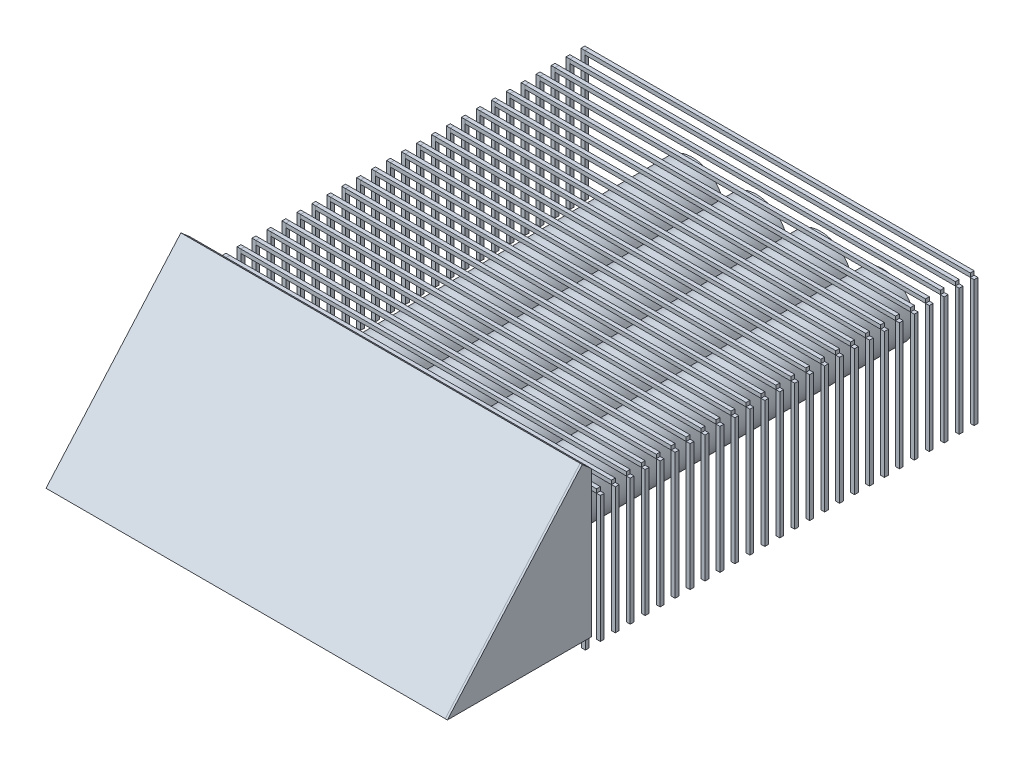
from build123d import *

# Parameters (mm, degrees)
SKETCH1_R              = 150
BOSS_EXTRUDE2_DEPTH    = 2000
BOSS_EXTRUDE2_2_DEPTH  = 2000
SKETCH1_R_2            = 143.570198384
BOSS_EXTRUDE2_3_DEPTH  = 2000
BOSS_EXTRUDE2_4_DEPTH  = 2000
EXTRUDE_THIN1_START    = -1430
EXTRUDE_THIN1_DEPTH    = 1859
SKETCH3_W              = 18
SKETCH3_H              = 592
BOSS_EXTRUDE3_DEPTH    = 18
BOSS_EXTRUDE3_2_DEPTH  = 18
BOSS_EXTRUDE3_3_DEPTH  = 18
BOSS_EXTRUDE3_4_DEPTH  = 18
BOSS_EXTRUDE3_5_DEPTH  = 18
BOSS_EXTRUDE3_6_DEPTH  = 18
BOSS_EXTRUDE3_7_DEPTH  = 18
BOSS_EXTRUDE3_8_DEPTH  = 18
BOSS_EXTRUDE3_9_DEPTH  = 18
BOSS_EXTRUDE3_10_DEPTH = 18
BOSS_EXTRUDE3_11_DEPTH = 18
BOSS_EXTRUDE3_12_DEPTH = 18
BOSS_EXTRUDE3_13_DEPTH = 18
BOSS_EXTRUDE3_14_DEPTH = 18
BOSS_EXTRUDE3_15_DEPTH = 18
BOSS_EXTRUDE3_16_DEPTH = 18
BOSS_EXTRUDE3_17_DEPTH = 18
BOSS_EXTRUDE3_18_DEPTH = 18
BOSS_EXTRUDE3_19_DEPTH = 18
BOSS_EXTRUDE3_20_DEPTH = 18
BOSS_EXTRUDE3_21_DEPTH = 18
BOSS_EXTRUDE3_22_DEPTH = 18
BOSS_EXTRUDE3_23_DEPTH = 18
BOSS_EXTRUDE3_24_DEPTH = 18
BOSS_EXTRUDE3_25_DEPTH = 18
BOSS_EXTRUDE3_26_DEPTH = 18
BOSS_EXTRUDE3_27_DEPTH = 18
SKETCH4_W              = 1804.350056171
SKETCH4_H              = 18
BOSS_EXTRUDE4_DEPTH    = 18
BOSS_EXTRUDE4_2_DEPTH  = 18
BOSS_EXTRUDE4_3_DEPTH  = 18
BOSS_EXTRUDE4_4_DEPTH  = 18
BOSS_EXTRUDE4_5_DEPTH  = 18
BOSS_EXTRUDE4_6_DEPTH  = 18
BOSS_EXTRUDE4_7_DEPTH  = 18
BOSS_EXTRUDE4_8_DEPTH  = 18
BOSS_EXTRUDE4_9_DEPTH  = 18
BOSS_EXTRUDE4_10_DEPTH = 18
BOSS_EXTRUDE4_11_DEPTH = 18
BOSS_EXTRUDE4_12_DEPTH = 18
BOSS_EXTRUDE4_13_DEPTH = 18
BOSS_EXTRUDE4_14_DEPTH = 18
BOSS_EXTRUDE4_15_DEPTH = 18
BOSS_EXTRUDE4_16_DEPTH = 18
BOSS_EXTRUDE4_17_DEPTH = 18
BOSS_EXTRUDE4_18_DEPTH = 18
BOSS_EXTRUDE4_19_DEPTH = 18
BOSS_EXTRUDE4_20_DEPTH = 18
BOSS_EXTRUDE4_21_DEPTH = 18
BOSS_EXTRUDE4_22_DEPTH = 18
BOSS_EXTRUDE4_23_DEPTH = 18
BOSS_EXTRUDE4_24_DEPTH = 18
BOSS_EXTRUDE4_25_DEPTH = 18
BOSS_EXTRUDE4_26_DEPTH = 18
BOSS_EXTRUDE4_27_DEPTH = 18
BOSS_EXTRUDE4_28_DEPTH = 18
SKETCH5_W              = 18
SKETCH5_H              = 610
BOSS_EXTRUDE5_DEPTH    = 18
BOSS_EXTRUDE6_DEPTH    = 10
BOSS_EXTRUDE7_DEPTH    = 10


# Read off the part's stored shape, not the designer's step: Extrude-Thin1
with BuildPart() as part:
    # Sketch1 → Boss-Extrude2 (new body)
    with BuildSketch(Plane.XY):
        with Locations((-958.339749738, -353.083207561)):
            Circle(SKETCH1_R)
    extrude(amount=BOSS_EXTRUDE2_DEPTH)


with BuildPart() as body_2:
    # Sketch1 → Boss-Extrude2 2 (new body)
    with BuildSketch(Plane.XY):
        with Locations((-658.339749738, -353.083207561)):
            Circle(SKETCH1_R)
    extrude(amount=BOSS_EXTRUDE2_2_DEPTH)


with BuildPart() as body_3:
    # Sketch1 → Boss-Extrude2 3 (new body)
    with BuildSketch(Plane.XY):
        with Locations((-64.769551354, -353.083207561)):
            Circle(SKETCH1_R_2)
    extrude(amount=BOSS_EXTRUDE2_3_DEPTH)


with BuildPart() as body_4:
    # Sketch1 → Boss-Extrude2 4 (new body)
    with BuildSketch(Plane.XY):
        with Locations((-358.339749738, -353.083207561)):
            Circle(SKETCH1_R)
    extrude(amount=BOSS_EXTRUDE2_4_DEPTH)


with BuildPart() as body_5:
    # Extrude-Thin1 outline → Extrude-Thin1 (new body)
    with BuildSketch(Plane(origin=(0, 0, 0), x_dir=(0, 0, -1), z_dir=(1, 0, 0)).offset(EXTRUDE_THIN1_START)):
        Polygon((-2466.56998023, -513.083207561), (-1869.132708893, 168.164895882), (-1913.207108363, 206.817023972), (-2544.541313609, -513.083207561), align=None)
        Polygon((-1912.282153442, 192.705168729), (-1883.244564136, 167.23994096), (-2471.100927688, -503.083207561), (-2522.470874494, -503.083207561), align=None, mode=Mode.SUBTRACT)
    extrude(amount=EXTRUDE_THIN1_DEPTH)

    # Sketch7 → Boss-Extrude7 (add)
    with BuildSketch(Plane.ZY.offset(1430)):
        Polygon((1913.207108363, 206.817023972), (1869.132708893, 168.164895882), (1888.666023324, -513.083207561), (2544.541313609, -513.083207561), align=None)
    extrude(amount=BOSS_EXTRUDE7_DEPTH)


with BuildPart() as body_6:
    # Sketch3 → Boss-Extrude3 (new body)
    with BuildSketch(Plane(origin=(429, 0, 0), x_dir=(0, 0, -1), z_dir=(1, 0, 0))):
        with Locations((-1879.666023324, -266.786552039)):
            Rectangle(SKETCH3_W, SKETCH3_H)
    extrude(amount=-BOSS_EXTRUDE3_DEPTH)

    # Sketch6 → Boss-Extrude6 (add)
    with BuildSketch(Plane(origin=(429, 0, 0), x_dir=(0, 0, -1), z_dir=(1, 0, 0))):
        Polygon((-2544.541313609, -513.083207561), (-1913.207108363, 206.817023972), (-1869.132708893, 168.164895882), (-1869.132708893, -513.083207561), align=None)
    extrude(amount=BOSS_EXTRUDE6_DEPTH)


with BuildPart() as body_7:
    # Sketch3 → Boss-Extrude3 2 (new body)
    with BuildSketch(Plane(origin=(429, 0, 0), x_dir=(0, 0, -1), z_dir=(1, 0, 0))):
        with Locations((-1809.666023324, -266.786552039)):
            Rectangle(SKETCH3_W, SKETCH3_H)
    extrude(amount=-BOSS_EXTRUDE3_2_DEPTH)


with BuildPart() as body_8:
    # Sketch3 → Boss-Extrude3 3 (new body)
    with BuildSketch(Plane(origin=(429, 0, 0), x_dir=(0, 0, -1), z_dir=(1, 0, 0))):
        with Locations((-1739.666023324, -266.786552039)):
            Rectangle(SKETCH3_W, SKETCH3_H)
    extrude(amount=-BOSS_EXTRUDE3_3_DEPTH)


with BuildPart() as body_9:
    # Sketch3 → Boss-Extrude3 4 (new body)
    with BuildSketch(Plane(origin=(429, 0, 0), x_dir=(0, 0, -1), z_dir=(1, 0, 0))):
        with Locations((-1669.666023324, -266.786552039)):
            Rectangle(SKETCH3_W, SKETCH3_H)
    extrude(amount=-BOSS_EXTRUDE3_4_DEPTH)


with BuildPart() as body_10:
    # Sketch3 → Boss-Extrude3 5 (new body)
    with BuildSketch(Plane(origin=(429, 0, 0), x_dir=(0, 0, -1), z_dir=(1, 0, 0))):
        with Locations((-1599.666023324, -266.786552039)):
            Rectangle(SKETCH3_W, SKETCH3_H)
    extrude(amount=-BOSS_EXTRUDE3_5_DEPTH)


with BuildPart() as body_11:
    # Sketch3 → Boss-Extrude3 6 (new body)
    with BuildSketch(Plane(origin=(429, 0, 0), x_dir=(0, 0, -1), z_dir=(1, 0, 0))):
        with Locations((-1529.666023324, -266.786552039)):
            Rectangle(SKETCH3_W, SKETCH3_H)
    extrude(amount=-BOSS_EXTRUDE3_6_DEPTH)


with BuildPart() as body_12:
    # Sketch3 → Boss-Extrude3 7 (new body)
    with BuildSketch(Plane(origin=(429, 0, 0), x_dir=(0, 0, -1), z_dir=(1, 0, 0))):
        with Locations((-1459.666023324, -266.786552039)):
            Rectangle(SKETCH3_W, SKETCH3_H)
    extrude(amount=-BOSS_EXTRUDE3_7_DEPTH)


with BuildPart() as body_13:
    # Sketch3 → Boss-Extrude3 8 (new body)
    with BuildSketch(Plane(origin=(429, 0, 0), x_dir=(0, 0, -1), z_dir=(1, 0, 0))):
        with Locations((-1389.666023324, -266.786552039)):
            Rectangle(SKETCH3_W, SKETCH3_H)
    extrude(amount=-BOSS_EXTRUDE3_8_DEPTH)


with BuildPart() as body_14:
    # Sketch3 → Boss-Extrude3 9 (new body)
    with BuildSketch(Plane(origin=(429, 0, 0), x_dir=(0, 0, -1), z_dir=(1, 0, 0))):
        with Locations((-1319.666023324, -266.786552039)):
            Rectangle(SKETCH3_W, SKETCH3_H)
    extrude(amount=-BOSS_EXTRUDE3_9_DEPTH)


with BuildPart() as body_15:
    # Sketch3 → Boss-Extrude3 10 (new body)
    with BuildSketch(Plane(origin=(429, 0, 0), x_dir=(0, 0, -1), z_dir=(1, 0, 0))):
        with Locations((-1249.666023324, -266.786552039)):
            Rectangle(SKETCH3_W, SKETCH3_H)
    extrude(amount=-BOSS_EXTRUDE3_10_DEPTH)


with BuildPart() as body_16:
    # Sketch3 → Boss-Extrude3 11 (new body)
    with BuildSketch(Plane(origin=(429, 0, 0), x_dir=(0, 0, -1), z_dir=(1, 0, 0))):
        with Locations((-1179.666023324, -266.786552039)):
            Rectangle(SKETCH3_W, SKETCH3_H)
    extrude(amount=-BOSS_EXTRUDE3_11_DEPTH)


with BuildPart() as body_17:
    # Sketch3 → Boss-Extrude3 12 (new body)
    with BuildSketch(Plane(origin=(429, 0, 0), x_dir=(0, 0, -1), z_dir=(1, 0, 0))):
        with Locations((-1109.666023324, -266.786552039)):
            Rectangle(SKETCH3_W, SKETCH3_H)
    extrude(amount=-BOSS_EXTRUDE3_12_DEPTH)


with BuildPart() as body_18:
    # Sketch3 → Boss-Extrude3 13 (new body)
    with BuildSketch(Plane(origin=(429, 0, 0), x_dir=(0, 0, -1), z_dir=(1, 0, 0))):
        with Locations((-1039.666023324, -266.786552039)):
            Rectangle(SKETCH3_W, SKETCH3_H)
    extrude(amount=-BOSS_EXTRUDE3_13_DEPTH)


with BuildPart() as body_19:
    # Sketch3 → Boss-Extrude3 14 (new body)
    with BuildSketch(Plane(origin=(429, 0, 0), x_dir=(0, 0, -1), z_dir=(1, 0, 0))):
        with Locations((-969.666023324, -266.786552039)):
            Rectangle(SKETCH3_W, SKETCH3_H)
    extrude(amount=-BOSS_EXTRUDE3_14_DEPTH)


with BuildPart() as body_20:
    # Sketch3 → Boss-Extrude3 15 (new body)
    with BuildSketch(Plane(origin=(429, 0, 0), x_dir=(0, 0, -1), z_dir=(1, 0, 0))):
        with Locations((-899.666023324, -266.786552039)):
            Rectangle(SKETCH3_W, SKETCH3_H)
    extrude(amount=-BOSS_EXTRUDE3_15_DEPTH)


with BuildPart() as body_21:
    # Sketch3 → Boss-Extrude3 16 (new body)
    with BuildSketch(Plane(origin=(429, 0, 0), x_dir=(0, 0, -1), z_dir=(1, 0, 0))):
        with Locations((-829.666023324, -266.786552039)):
            Rectangle(SKETCH3_W, SKETCH3_H)
    extrude(amount=-BOSS_EXTRUDE3_16_DEPTH)


with BuildPart() as body_22:
    # Sketch3 → Boss-Extrude3 17 (new body)
    with BuildSketch(Plane(origin=(429, 0, 0), x_dir=(0, 0, -1), z_dir=(1, 0, 0))):
        with Locations((-759.666023324, -266.786552039)):
            Rectangle(SKETCH3_W, SKETCH3_H)
    extrude(amount=-BOSS_EXTRUDE3_17_DEPTH)


with BuildPart() as body_23:
    # Sketch3 → Boss-Extrude3 18 (new body)
    with BuildSketch(Plane(origin=(429, 0, 0), x_dir=(0, 0, -1), z_dir=(1, 0, 0))):
        with Locations((-689.666023324, -266.786552039)):
            Rectangle(SKETCH3_W, SKETCH3_H)
    extrude(amount=-BOSS_EXTRUDE3_18_DEPTH)


with BuildPart() as body_24:
    # Sketch3 → Boss-Extrude3 19 (new body)
    with BuildSketch(Plane(origin=(429, 0, 0), x_dir=(0, 0, -1), z_dir=(1, 0, 0))):
        with Locations((-619.666023324, -266.786552039)):
            Rectangle(SKETCH3_W, SKETCH3_H)
    extrude(amount=-BOSS_EXTRUDE3_19_DEPTH)


with BuildPart() as body_25:
    # Sketch3 → Boss-Extrude3 20 (new body)
    with BuildSketch(Plane(origin=(429, 0, 0), x_dir=(0, 0, -1), z_dir=(1, 0, 0))):
        with Locations((-549.666023324, -266.786552039)):
            Rectangle(SKETCH3_W, SKETCH3_H)
    extrude(amount=-BOSS_EXTRUDE3_20_DEPTH)


with BuildPart() as body_26:
    # Sketch3 → Boss-Extrude3 21 (new body)
    with BuildSketch(Plane(origin=(429, 0, 0), x_dir=(0, 0, -1), z_dir=(1, 0, 0))):
        with Locations((-479.666023324, -266.786552039)):
            Rectangle(SKETCH3_W, SKETCH3_H)
    extrude(amount=-BOSS_EXTRUDE3_21_DEPTH)


with BuildPart() as body_27:
    # Sketch3 → Boss-Extrude3 22 (new body)
    with BuildSketch(Plane(origin=(429, 0, 0), x_dir=(0, 0, -1), z_dir=(1, 0, 0))):
        with Locations((-409.666023324, -266.786552039)):
            Rectangle(SKETCH3_W, SKETCH3_H)
    extrude(amount=-BOSS_EXTRUDE3_22_DEPTH)


with BuildPart() as body_28:
    # Sketch3 → Boss-Extrude3 23 (new body)
    with BuildSketch(Plane(origin=(429, 0, 0), x_dir=(0, 0, -1), z_dir=(1, 0, 0))):
        with Locations((-339.666023324, -266.786552039)):
            Rectangle(SKETCH3_W, SKETCH3_H)
    extrude(amount=-BOSS_EXTRUDE3_23_DEPTH)


with BuildPart() as body_29:
    # Sketch3 → Boss-Extrude3 24 (new body)
    with BuildSketch(Plane(origin=(429, 0, 0), x_dir=(0, 0, -1), z_dir=(1, 0, 0))):
        with Locations((-269.666023324, -266.786552039)):
            Rectangle(SKETCH3_W, SKETCH3_H)
    extrude(amount=-BOSS_EXTRUDE3_24_DEPTH)


with BuildPart() as body_30:
    # Sketch3 → Boss-Extrude3 25 (new body)
    with BuildSketch(Plane(origin=(429, 0, 0), x_dir=(0, 0, -1), z_dir=(1, 0, 0))):
        with Locations((-199.666023324, -266.786552039)):
            Rectangle(SKETCH3_W, SKETCH3_H)
    extrude(amount=-BOSS_EXTRUDE3_25_DEPTH)


with BuildPart() as body_31:
    # Sketch3 → Boss-Extrude3 26 (new body)
    with BuildSketch(Plane(origin=(429, 0, 0), x_dir=(0, 0, -1), z_dir=(1, 0, 0))):
        with Locations((-129.666023324, -266.786552039)):
            Rectangle(SKETCH3_W, SKETCH3_H)
    extrude(amount=-BOSS_EXTRUDE3_26_DEPTH)


with BuildPart() as body_32:
    # Sketch3 → Boss-Extrude3 27 (new body)
    with BuildSketch(Plane(origin=(429, 0, 0), x_dir=(0, 0, -1), z_dir=(1, 0, 0))):
        with Locations((-59.666023324, -266.786552039)):
            Rectangle(SKETCH3_W, SKETCH3_H)
    extrude(amount=-BOSS_EXTRUDE3_27_DEPTH)


with BuildPart() as body_33:
    # Sketch4 → Boss-Extrude4 (new body)
    with BuildSketch(Plane(origin=(0, 29.213447961, 0), x_dir=(1, 0, 0), z_dir=(0, 1, 0))):
        with Locations((-491.175028086, -59.666023324)):
            Rectangle(SKETCH4_W, SKETCH4_H)
    extrude(amount=BOSS_EXTRUDE4_DEPTH)


with BuildPart() as body_34:
    # Sketch4 → Boss-Extrude4 2 (new body)
    with BuildSketch(Plane(origin=(0, 29.213447961, 0), x_dir=(1, 0, 0), z_dir=(0, 1, 0))):
        with Locations((-491.175028086, -129.666023324)):
            Rectangle(SKETCH4_W, SKETCH4_H)
    extrude(amount=BOSS_EXTRUDE4_2_DEPTH)


with BuildPart() as body_35:
    # Sketch4 → Boss-Extrude4 3 (new body)
    with BuildSketch(Plane(origin=(0, 29.213447961, 0), x_dir=(1, 0, 0), z_dir=(0, 1, 0))):
        with Locations((-491.175028086, -199.666023324)):
            Rectangle(SKETCH4_W, SKETCH4_H)
    extrude(amount=BOSS_EXTRUDE4_3_DEPTH)


with BuildPart() as body_36:
    # Sketch4 → Boss-Extrude4 4 (new body)
    with BuildSketch(Plane(origin=(0, 29.213447961, 0), x_dir=(1, 0, 0), z_dir=(0, 1, 0))):
        with Locations((-491.175028086, -269.666023324)):
            Rectangle(SKETCH4_W, SKETCH4_H)
    extrude(amount=BOSS_EXTRUDE4_4_DEPTH)


with BuildPart() as body_37:
    # Sketch4 → Boss-Extrude4 5 (new body)
    with BuildSketch(Plane(origin=(0, 29.213447961, 0), x_dir=(1, 0, 0), z_dir=(0, 1, 0))):
        with Locations((-491.175028086, -339.666023324)):
            Rectangle(SKETCH4_W, SKETCH4_H)
    extrude(amount=BOSS_EXTRUDE4_5_DEPTH)


with BuildPart() as body_38:
    # Sketch4 → Boss-Extrude4 6 (new body)
    with BuildSketch(Plane(origin=(0, 29.213447961, 0), x_dir=(1, 0, 0), z_dir=(0, 1, 0))):
        with Locations((-491.175028086, -409.666023324)):
            Rectangle(SKETCH4_W, SKETCH4_H)
    extrude(amount=BOSS_EXTRUDE4_6_DEPTH)


with BuildPart() as body_39:
    # Sketch4 → Boss-Extrude4 7 (new body)
    with BuildSketch(Plane(origin=(0, 29.213447961, 0), x_dir=(1, 0, 0), z_dir=(0, 1, 0))):
        with Locations((-491.175028086, -479.666023324)):
            Rectangle(SKETCH4_W, SKETCH4_H)
    extrude(amount=BOSS_EXTRUDE4_7_DEPTH)


with BuildPart() as body_40:
    # Sketch4 → Boss-Extrude4 8 (new body)
    with BuildSketch(Plane(origin=(0, 29.213447961, 0), x_dir=(1, 0, 0), z_dir=(0, 1, 0))):
        with Locations((-491.175028086, -549.666023324)):
            Rectangle(SKETCH4_W, SKETCH4_H)
    extrude(amount=BOSS_EXTRUDE4_8_DEPTH)


with BuildPart() as body_41:
    # Sketch4 → Boss-Extrude4 9 (new body)
    with BuildSketch(Plane(origin=(0, 29.213447961, 0), x_dir=(1, 0, 0), z_dir=(0, 1, 0))):
        with Locations((-491.175028086, -619.666023324)):
            Rectangle(SKETCH4_W, SKETCH4_H)
    extrude(amount=BOSS_EXTRUDE4_9_DEPTH)


with BuildPart() as body_42:
    # Sketch4 → Boss-Extrude4 10 (new body)
    with BuildSketch(Plane(origin=(0, 29.213447961, 0), x_dir=(1, 0, 0), z_dir=(0, 1, 0))):
        with Locations((-491.175028086, -689.666023324)):
            Rectangle(SKETCH4_W, SKETCH4_H)
    extrude(amount=BOSS_EXTRUDE4_10_DEPTH)


with BuildPart() as body_43:
    # Sketch4 → Boss-Extrude4 11 (new body)
    with BuildSketch(Plane(origin=(0, 29.213447961, 0), x_dir=(1, 0, 0), z_dir=(0, 1, 0))):
        with Locations((-491.175028086, -759.666023324)):
            Rectangle(SKETCH4_W, SKETCH4_H)
    extrude(amount=BOSS_EXTRUDE4_11_DEPTH)


with BuildPart() as body_44:
    # Sketch4 → Boss-Extrude4 12 (new body)
    with BuildSketch(Plane(origin=(0, 29.213447961, 0), x_dir=(1, 0, 0), z_dir=(0, 1, 0))):
        with Locations((-491.175028086, -829.666023324)):
            Rectangle(SKETCH4_W, SKETCH4_H)
    extrude(amount=BOSS_EXTRUDE4_12_DEPTH)


with BuildPart() as body_45:
    # Sketch4 → Boss-Extrude4 13 (new body)
    with BuildSketch(Plane(origin=(0, 29.213447961, 0), x_dir=(1, 0, 0), z_dir=(0, 1, 0))):
        with Locations((-491.175028086, -899.666023324)):
            Rectangle(SKETCH4_W, SKETCH4_H)
    extrude(amount=BOSS_EXTRUDE4_13_DEPTH)


with BuildPart() as body_46:
    # Sketch4 → Boss-Extrude4 14 (new body)
    with BuildSketch(Plane(origin=(0, 29.213447961, 0), x_dir=(1, 0, 0), z_dir=(0, 1, 0))):
        with Locations((-491.175028086, -969.666023324)):
            Rectangle(SKETCH4_W, SKETCH4_H)
    extrude(amount=BOSS_EXTRUDE4_14_DEPTH)


with BuildPart() as body_47:
    # Sketch4 → Boss-Extrude4 15 (new body)
    with BuildSketch(Plane(origin=(0, 29.213447961, 0), x_dir=(1, 0, 0), z_dir=(0, 1, 0))):
        with Locations((-491.175028086, -1039.666023324)):
            Rectangle(SKETCH4_W, SKETCH4_H)
    extrude(amount=BOSS_EXTRUDE4_15_DEPTH)


with BuildPart() as body_48:
    # Sketch4 → Boss-Extrude4 16 (new body)
    with BuildSketch(Plane(origin=(0, 29.213447961, 0), x_dir=(1, 0, 0), z_dir=(0, 1, 0))):
        with Locations((-491.175028086, -1109.666023324)):
            Rectangle(SKETCH4_W, SKETCH4_H)
    extrude(amount=BOSS_EXTRUDE4_16_DEPTH)


with BuildPart() as body_49:
    # Sketch4 → Boss-Extrude4 17 (new body)
    with BuildSketch(Plane(origin=(0, 29.213447961, 0), x_dir=(1, 0, 0), z_dir=(0, 1, 0))):
        with Locations((-491.175028086, -1179.666023324)):
            Rectangle(SKETCH4_W, SKETCH4_H)
    extrude(amount=BOSS_EXTRUDE4_17_DEPTH)


with BuildPart() as body_50:
    # Sketch4 → Boss-Extrude4 18 (new body)
    with BuildSketch(Plane(origin=(0, 29.213447961, 0), x_dir=(1, 0, 0), z_dir=(0, 1, 0))):
        with Locations((-491.175028086, -1249.666023324)):
            Rectangle(SKETCH4_W, SKETCH4_H)
    extrude(amount=BOSS_EXTRUDE4_18_DEPTH)


with BuildPart() as body_51:
    # Sketch4 → Boss-Extrude4 19 (new body)
    with BuildSketch(Plane(origin=(0, 29.213447961, 0), x_dir=(1, 0, 0), z_dir=(0, 1, 0))):
        with Locations((-491.175028086, -1319.666023324)):
            Rectangle(SKETCH4_W, SKETCH4_H)
    extrude(amount=BOSS_EXTRUDE4_19_DEPTH)


with BuildPart() as body_52:
    # Sketch4 → Boss-Extrude4 20 (new body)
    with BuildSketch(Plane(origin=(0, 29.213447961, 0), x_dir=(1, 0, 0), z_dir=(0, 1, 0))):
        with Locations((-491.175028086, -1389.666023324)):
            Rectangle(SKETCH4_W, SKETCH4_H)
    extrude(amount=BOSS_EXTRUDE4_20_DEPTH)


with BuildPart() as body_53:
    # Sketch4 → Boss-Extrude4 21 (new body)
    with BuildSketch(Plane(origin=(0, 29.213447961, 0), x_dir=(1, 0, 0), z_dir=(0, 1, 0))):
        with Locations((-491.175028086, -1459.666023324)):
            Rectangle(SKETCH4_W, SKETCH4_H)
    extrude(amount=BOSS_EXTRUDE4_21_DEPTH)


with BuildPart() as body_54:
    # Sketch4 → Boss-Extrude4 22 (new body)
    with BuildSketch(Plane(origin=(0, 29.213447961, 0), x_dir=(1, 0, 0), z_dir=(0, 1, 0))):
        with Locations((-491.175028086, -1529.666023324)):
            Rectangle(SKETCH4_W, SKETCH4_H)
    extrude(amount=BOSS_EXTRUDE4_22_DEPTH)


with BuildPart() as body_55:
    # Sketch4 → Boss-Extrude4 23 (new body)
    with BuildSketch(Plane(origin=(0, 29.213447961, 0), x_dir=(1, 0, 0), z_dir=(0, 1, 0))):
        with Locations((-491.175028086, -1599.666023324)):
            Rectangle(SKETCH4_W, SKETCH4_H)
    extrude(amount=BOSS_EXTRUDE4_23_DEPTH)


with BuildPart() as body_56:
    # Sketch4 → Boss-Extrude4 24 (new body)
    with BuildSketch(Plane(origin=(0, 29.213447961, 0), x_dir=(1, 0, 0), z_dir=(0, 1, 0))):
        with Locations((-491.175028086, -1669.666023324)):
            Rectangle(SKETCH4_W, SKETCH4_H)
    extrude(amount=BOSS_EXTRUDE4_24_DEPTH)


with BuildPart() as body_57:
    # Sketch4 → Boss-Extrude4 25 (new body)
    with BuildSketch(Plane(origin=(0, 29.213447961, 0), x_dir=(1, 0, 0), z_dir=(0, 1, 0))):
        with Locations((-491.175028086, -1739.666023324)):
            Rectangle(SKETCH4_W, SKETCH4_H)
    extrude(amount=BOSS_EXTRUDE4_25_DEPTH)


with BuildPart() as body_58:
    # Sketch4 → Boss-Extrude4 26 (new body)
    with BuildSketch(Plane(origin=(0, 29.213447961, 0), x_dir=(1, 0, 0), z_dir=(0, 1, 0))):
        with Locations((-491.175028086, -1809.666023324)):
            Rectangle(SKETCH4_W, SKETCH4_H)
    extrude(amount=BOSS_EXTRUDE4_26_DEPTH)


with BuildPart() as body_59:
    # Sketch4 → Boss-Extrude4 27 (new body)
    with BuildSketch(Plane(origin=(0, 29.213447961, 0), x_dir=(1, 0, 0), z_dir=(0, 1, 0))):
        with Locations((-491.175028086, -1879.666023324)):
            Rectangle(SKETCH4_W, SKETCH4_H)
    extrude(amount=BOSS_EXTRUDE4_27_DEPTH)


with BuildPart() as body_60:
    # Sketch4 → Boss-Extrude4 28 (new body)
    with BuildSketch(Plane(origin=(0, 29.213447961, 0), x_dir=(1, 0, 0), z_dir=(0, 1, 0))):
        with Locations((-491.175028086, -1949.666023324)):
            Rectangle(SKETCH4_W, SKETCH4_H)
    extrude(amount=BOSS_EXTRUDE4_28_DEPTH)

    # Sketch5 → Boss-Extrude5 (add)
    with BuildSketch(Plane.ZY.offset(1393.350056171)):
        with Locations((129.666023324, -257.786552039)):
            Rectangle(SKETCH5_W, SKETCH5_H)
        with Locations((59.666023324, -257.786552039)):
            Rectangle(SKETCH5_W, SKETCH5_H)
        with Locations((199.666023324, -257.786552039)):
            Rectangle(SKETCH5_W, SKETCH5_H)
        with Locations((269.666023324, -257.786552039)):
            Rectangle(SKETCH5_W, SKETCH5_H)
        with Locations((339.666023324, -257.786552039)):
            Rectangle(SKETCH5_W, SKETCH5_H)
        with Locations((409.666023324, -257.786552039)):
            Rectangle(SKETCH5_W, SKETCH5_H)
        with Locations((479.666023324, -257.786552039)):
            Rectangle(SKETCH5_W, SKETCH5_H)
        with Locations((549.666023324, -257.786552039)):
            Rectangle(SKETCH5_W, SKETCH5_H)
        with Locations((619.666023324, -257.786552039)):
            Rectangle(SKETCH5_W, SKETCH5_H)
        with Locations((689.666023324, -257.786552039)):
            Rectangle(SKETCH5_W, SKETCH5_H)
        with Locations((759.666023324, -257.786552039)):
            Rectangle(SKETCH5_W, SKETCH5_H)
        with Locations((829.666023324, -257.786552039)):
            Rectangle(SKETCH5_W, SKETCH5_H)
        with Locations((899.666023324, -257.786552039)):
            Rectangle(SKETCH5_W, SKETCH5_H)
        with Locations((969.666023324, -257.786552039)):
            Rectangle(SKETCH5_W, SKETCH5_H)
        with Locations((1039.666023324, -257.786552039)):
            Rectangle(SKETCH5_W, SKETCH5_H)
        with Locations((1109.666023324, -257.786552039)):
            Rectangle(SKETCH5_W, SKETCH5_H)
        with Locations((1179.666023324, -257.786552039)):
            Rectangle(SKETCH5_W, SKETCH5_H)
        with Locations((1249.666023324, -257.786552039)):
            Rectangle(SKETCH5_W, SKETCH5_H)
        with Locations((1319.666023324, -257.786552039)):
            Rectangle(SKETCH5_W, SKETCH5_H)
        with Locations((1389.666023324, -257.786552039)):
            Rectangle(SKETCH5_W, SKETCH5_H)
        with Locations((1459.666023324, -257.786552039)):
            Rectangle(SKETCH5_W, SKETCH5_H)
        with Locations((1529.666023324, -257.786552039)):
            Rectangle(SKETCH5_W, SKETCH5_H)
        with Locations((1599.666023324, -257.786552039)):
            Rectangle(SKETCH5_W, SKETCH5_H)
        with Locations((1669.666023324, -257.786552039)):
            Rectangle(SKETCH5_W, SKETCH5_H)
        with Locations((1739.666023324, -257.786552039)):
            Rectangle(SKETCH5_W, SKETCH5_H)
        with Locations((1809.666023324, -257.786552039)):
            Rectangle(SKETCH5_W, SKETCH5_H)
        with Locations((1879.666023324, -257.786552039)):
            Rectangle(SKETCH5_W, SKETCH5_H)
        with Locations((1949.666023324, -257.786552039)):
            Rectangle(SKETCH5_W, SKETCH5_H)
    extrude(amount=BOSS_EXTRUDE5_DEPTH)


solid = Compound([part.part, body_2.part, body_3.part, body_4.part, body_5.part, body_6.part, body_7.part, body_8.part, body_9.part, body_10.part, body_11.part, body_12.part, body_13.part, body_14.part, body_15.part, body_16.part, body_17.part, body_18.part, body_19.part, body_20.part, body_21.part, body_22.part, body_23.part, body_24.part, body_25.part, body_26.part, body_27.part, body_28.part, body_29.part, body_30.part, body_31.part, body_32.part, body_33.part, body_34.part, body_35.part, body_36.part, body_37.part, body_38.part, body_39.part, body_40.part, body_41.part, body_42.part, body_43.part, body_44.part, body_45.part, body_46.part, body_47.part, body_48.part, body_49.part, body_50.part, body_51.part, body_52.part, body_53.part, body_54.part, body_55.part, body_56.part, body_57.part, body_58.part, body_59.part, body_60.part])
